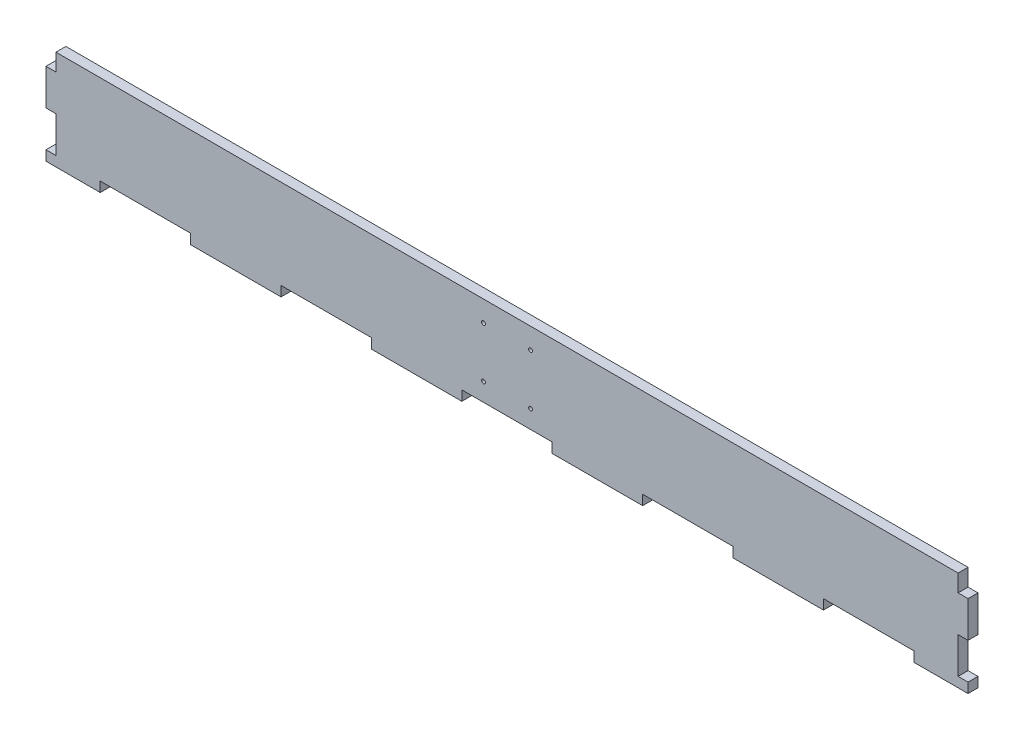
from build123d import *

# Parameters (mm, degrees)
SKETCH_1_W          = 510
SKETCH_1_H          = 55
EXTRUDE_1_DEPTH     = 5.5
SKETCH_2_W          = 50
SKETCH_2_H          = 5.5
CUT_EXTRUDE_1_DEPTH = 257.537521622
SKETCH_3_W          = 5.5
SKETCH_3_H          = 20
CUT_EXTRUDE_2_DEPTH = 257.537521622
SKETCH_4_R          = 1.05
CUT_EXTRUDE_3_DEPTH = 257.537521622


with BuildPart() as part:
    # ｽｹｯﾁ1 → ﾎﾞｽ - 押し出し1 (new body)
    with BuildSketch(Plane.XY):
        Rectangle(SKETCH_1_W, SKETCH_1_H)
    extrude(amount=EXTRUDE_1_DEPTH)

    # ｽｹｯﾁ2 → ｶｯﾄ - 押し出し1 (cut, through all)
    with BuildSketch(Plane.XY.offset(5.5)):
        with Locations((0, -24.75)):
            Rectangle(SKETCH_2_W, SKETCH_2_H)
        with Locations((-100, -24.75)):
            Rectangle(SKETCH_2_W, SKETCH_2_H)
        with Locations((100, -24.75)):
            Rectangle(SKETCH_2_W, SKETCH_2_H)
        with Locations((200, -24.75)):
            Rectangle(SKETCH_2_W, SKETCH_2_H)
        with Locations((-200, -24.75)):
            Rectangle(SKETCH_2_W, SKETCH_2_H)
    extrude(amount=-CUT_EXTRUDE_1_DEPTH, mode=Mode.SUBTRACT)

    # ｽｹｯﾁ3 → ｶｯﾄ - 押し出し2 (cut, through all)
    with BuildSketch(Plane.XY.offset(5.5)):
        with Locations((252.25, -12)):
            Rectangle(SKETCH_3_W, SKETCH_3_H)
        with Locations((252.25, 28)):
            Rectangle(SKETCH_3_W, SKETCH_3_H)
        with Locations((-252.25, 28)):
            Rectangle(SKETCH_3_W, SKETCH_3_H)
        with Locations((-252.25, -12)):
            Rectangle(SKETCH_3_W, SKETCH_3_H)
    extrude(amount=-CUT_EXTRUDE_2_DEPTH, mode=Mode.SUBTRACT)

    # ｽｹｯﾁ4 → ｶｯﾄ - 押し出し3 (cut, through all)
    with BuildSketch(Plane.XY.offset(5.5)):
        with Locations((13, -12)):
            Circle(SKETCH_4_R)
        with Locations((-13, -12)):
            Circle(SKETCH_4_R)
        with Locations((-13, 16)):
            Circle(SKETCH_4_R)
        with Locations((13, 16)):
            Circle(SKETCH_4_R)
    extrude(amount=-CUT_EXTRUDE_3_DEPTH, mode=Mode.SUBTRACT)


solid = part.part
